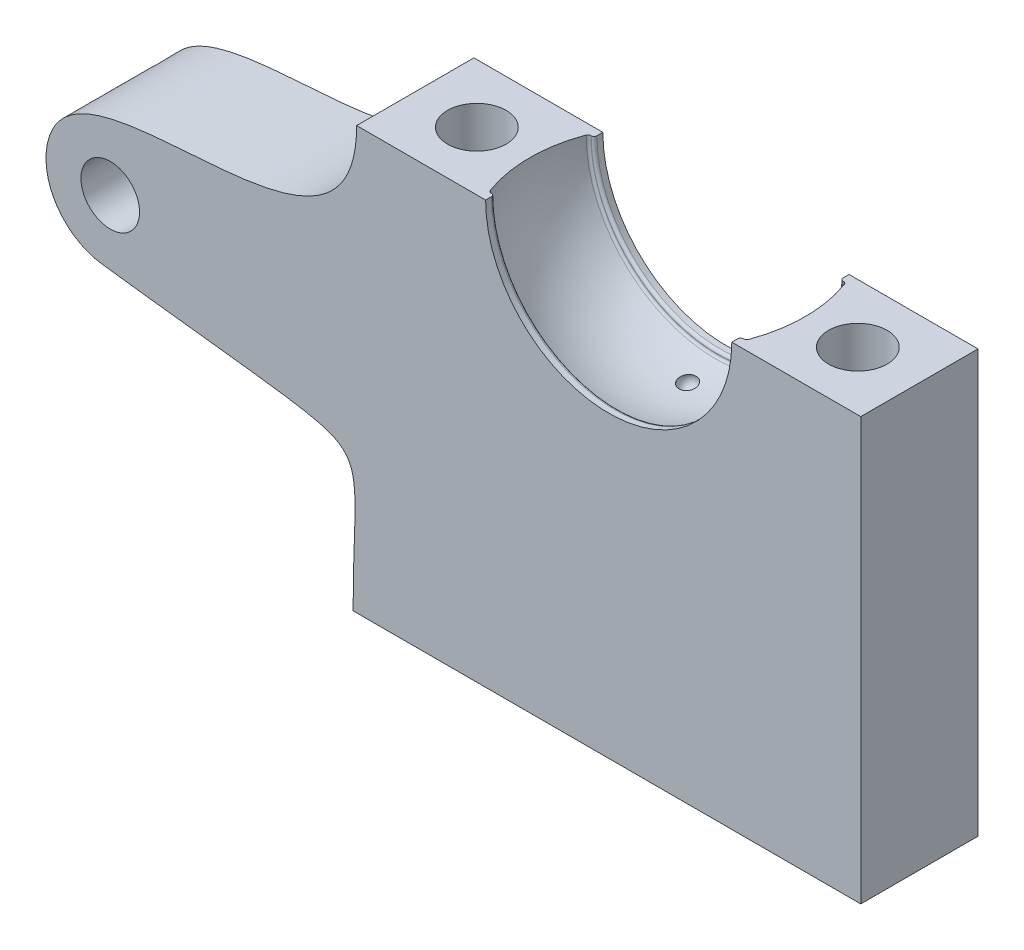
from build123d import *

# Parameters (mm, degrees)
SKETCH1_W           = 86
SKETCH1_H           = 72
BOSS_EXTRUDE1_DEPTH = 20
SKETCH2_R           = 5
CUT_EXTRUDE1_DEPTH  = 87.214847909
FILLET1_R           = 0.5
FILLET2_R           = 0.5
SKETCH6_W           = 20
SKETCH6_H           = 72
BOSS_EXTRUDE2_DEPTH = 53
CAVITY1_OUTLINE_R   = 5
CAVITY1_DEPTH       = 20
CUT_EXTRUDE2_DEPTH  = 122.65525076


# Read off the part's stored shape, not the designer's step: Cavity1
with BuildPart() as part:
    # Sketch1 → Boss-Extrude1 (new body)
    with BuildSketch(Plane.XY):
        with Locations((0, 36)):
            Rectangle(SKETCH1_W, SKETCH1_H)
    extrude(amount=BOSS_EXTRUDE1_DEPTH)

    # Sketch2 → Cut-Extrude1 (cut, through all)
    with BuildSketch(Plane(origin=(0, 0, 0), x_dir=(1, 0, 0), z_dir=(0, 1, 0))):
        with Locations(Location((-32.5, -10, 0), (0, 0, 270))):
            Circle(SKETCH2_R)
        with Locations(Location((32.5, -10, 0), (0, 0, 90))):
            Circle(SKETCH2_R)
    extrude(amount=CUT_EXTRUDE1_DEPTH, mode=Mode.SUBTRACT)

    # Sketch4 → Cut-Revolve1 (revolve, cut)
    with BuildSketch(Plane(origin=(0, 72, 0), x_dir=(-1, 0, 0), z_dir=(0, 1, 0))):
        with BuildLine():
            Line((0, 0), (0, 20))
            Line((0, 20), (21, 20))
            Line((21, 20), (21, 18.5))
            Line((21, 18.5), (21.9089023, 18.5))
            ThreePointArc((21.9089023, 18.5), (23.5, 10), (21.9089023, 1.5))
            Line((21.9089023, 1.5), (21, 1.5))
            Line((21, 1.5), (21, 0))
            Line((21, 0), (0, 0))
        make_face()
    revolve(axis=Axis((0, 72, 0), (0, 0, 1)), mode=Mode.SUBTRACT)

    # Sketch5 → Cut-Revolve2 (revolve, cut)
    with BuildSketch(Plane(origin=(0, 48.5, 0), x_dir=(1, 0, 0), z_dir=(0, 1, 0))):
        with BuildLine():
            Line((0, -5), (0, -8))
            ThreePointArc((0, -8), (-1.5, -6.5), (0, -5))
        make_face()
    revolve(axis=Axis((0, 48.5, 0), (0, 0, 1)), mode=Mode.SUBTRACT)

    # Fillet1
    fillet1_edges = [part.edges().sort_by_distance(p)[0] for p in [
        (0, 50.0910977, 18.5),
        (0, 50.0910977, 1.5),
    ]]
    fillet(fillet1_edges, radius=FILLET1_R)

    # Fillet2
    fillet2_edges = [part.edges().sort_by_distance(p)[0] for p in [
        (0, 51, 18.5),
        (0, 51, 1.5),
    ]]
    fillet(fillet2_edges, radius=FILLET2_R)

    # Sketch6 → Boss-Extrude2 (add)
    with BuildSketch(Plane(origin=(-43, 0, 0), x_dir=(0, 0, -1), z_dir=(1, 0, 0))):
        with Locations((-10, 36)):
            Rectangle(SKETCH6_W, SKETCH6_H)
    extrude(amount=-BOSS_EXTRUDE2_DEPTH)

    # Cavity1 outline → Cavity1 (cut)
    with BuildSketch(Plane.XY):
        with Locations((-85.036371952, 40.687381171)):
            Circle(CAVITY1_OUTLINE_R)
    extrude(amount=CAVITY1_DEPTH, mode=Mode.SUBTRACT)

    # Sketch8 → Cut-Extrude2 (cut, through all)
    with BuildSketch(Plane.XY.offset(20)):
        with BuildLine():
            Line((-43.611081488, 0), (-43.611081488, -5.76813428))
            Line((-43.611081488, -5.76813428), (-107.878292828, -5.76813428))
            Line((-107.878292828, -5.76813428), (-107.878292828, 57.33150687))
            Line((-107.878292828, 57.33150687), (-107.878292828, 72))
            Line((-107.878292828, 72), (-43, 72))
            add(Edge.make_bspline(
                [(-95.73694265, 43.074623662), (-91.28097288, 63.04805315), (-43, 42.337327556), (-43, 72)],
                knots=[0, 0, 0, 0, 1, 1, 1, 1], degree=3))
            ThreePointArc((-95.73694265, 43.074623662), (-95.93403723, 41.888227318), (-96, 40.687381171))
            ThreePointArc((-96, 40.687381171), (-93.288759206, 33.469400526), (-86.495984658, 29.821348283))
            add(Edge.make_bspline(
                [(-86.495984658, 29.821348283), (-76.006838116, 28.412361974), (-38.381653368, 24.579008499), (-43.611081488, 22.17214242), (-43.611081488, 0)],
                knots=[0, 0, 0, 0, 0.346709448, 1, 1, 1, 1], degree=3))
        make_face()
    extrude(amount=-CUT_EXTRUDE2_DEPTH, mode=Mode.SUBTRACT)


solid = part.part
